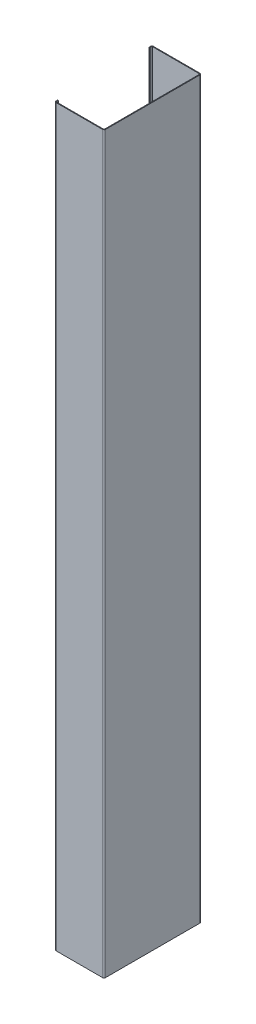
from build123d import *

# Parameters (mm, degrees)
SM_BASE_FLANGE_1_DEPTH = 743


# Sheet-metal steps are written as plain solids
with BuildPart() as part:
    # Sketch 1 → Базовая кромка1 (new body)
    with BuildSketch(Plane(origin=(0, 0, 0), x_dir=(1, 0, 0), z_dir=(0, 1, 0))):
        with BuildLine():
            Line((-50, 46.25), (-50, 47.75))
            ThreePointArc((-50, 47.75), (-49.560660172, 48.810660172), (-48.5, 49.25))
            Line((-48.5, 49.25), (-1.5, 49.25))
            ThreePointArc((-1.5, 49.25), (-0.439339828, 48.810660172), (0, 47.75))
            Line((0, 47.75), (0, -47.75))
            ThreePointArc((0, -47.75), (-0.439339828, -48.810660172), (-1.5, -49.25))
            Line((-1.5, -49.25), (-48.5, -49.25))
            ThreePointArc((-48.5, -49.25), (-49.560660172, -48.810660172), (-50, -47.75))
            Line((-50, -47.75), (-50, -46.25))
            Line((-50, -46.25), (-49.25, -46.25))
            Line((-49.25, -46.25), (-49.25, -47.75))
            ThreePointArc((-49.25, -47.75), (-49.030330086, -48.280330086), (-48.5, -48.5))
            Line((-48.5, -48.5), (-1.5, -48.5))
            ThreePointArc((-1.5, -48.5), (-0.969669914, -48.280330086), (-0.75, -47.75))
            Line((-0.75, -47.75), (-0.75, 47.75))
            ThreePointArc((-0.75, 47.75), (-0.969669914, 48.280330086), (-1.5, 48.5))
            Line((-1.5, 48.5), (-48.5, 48.5))
            ThreePointArc((-48.5, 48.5), (-49.030330086, 48.280330086), (-49.25, 47.75))
            Line((-49.25, 47.75), (-49.25, 46.25))
            Line((-49.25, 46.25), (-50, 46.25))
        make_face()
    extrude(amount=SM_BASE_FLANGE_1_DEPTH)


solid = part.part
